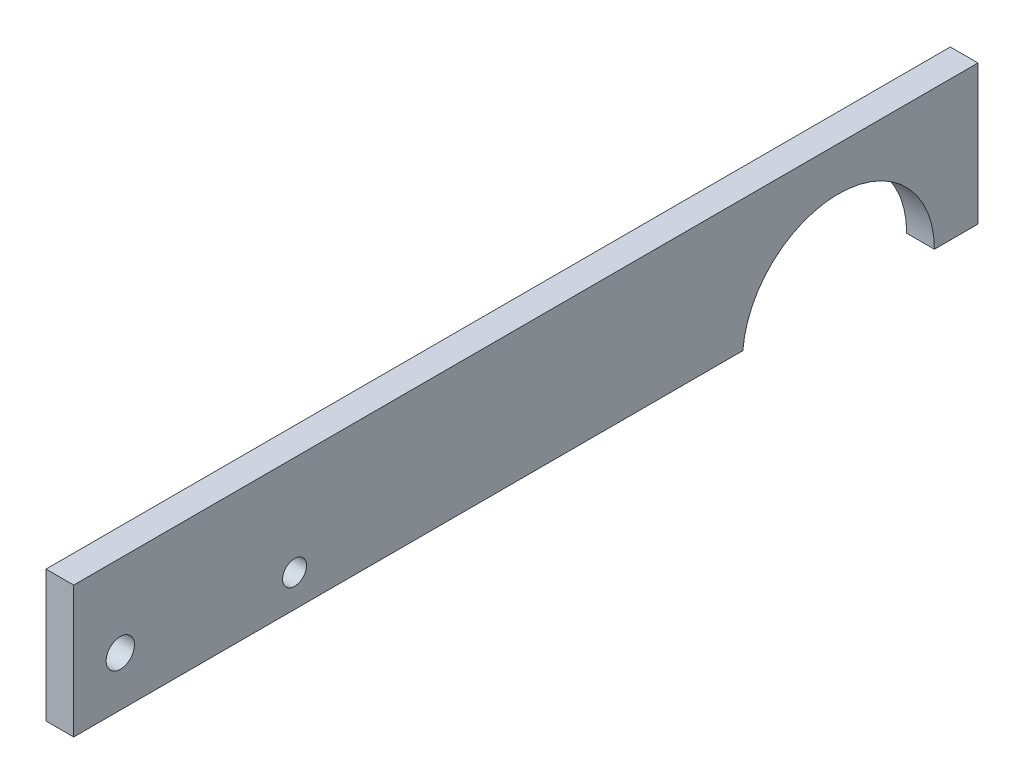
from build123d import *

# Parameters (mm, degrees)
SKETCH1_R           = 3.25
SKETCH1_R_2         = 2.75
BOSS_EXTRUDE1_DEPTH = 6.35


with BuildPart() as part:
    # Sketch1 → Boss-Extrude1 (new body)
    with BuildSketch(Plane(origin=(0, 0, 0), x_dir=(0, 0, -1), z_dir=(1, 0, 0))):
        with BuildLine():
            Line((-175.353584658, 32), (32, 32))
            Line((32, 32), (32, 0))
            Line((32, 0), (22, 0))
            ThreePointArc((22, 0), (0.91041892, 21.981154141), (-21.924648854, 1.819278055))
            Line((-21.924648854, 1.819278055), (-175.353584658, 1.819278055))
            Line((-175.353584658, 1.819278055), (-175.353584658, 32))
        make_face()
        with Locations((-164.67, 13.1796749)):
            Circle(SKETCH1_R, mode=Mode.SUBTRACT)
        with Locations((-124.71136572, 9.188125319)):
            Circle(SKETCH1_R_2, mode=Mode.SUBTRACT)
    extrude(amount=BOSS_EXTRUDE1_DEPTH)


solid = part.part
